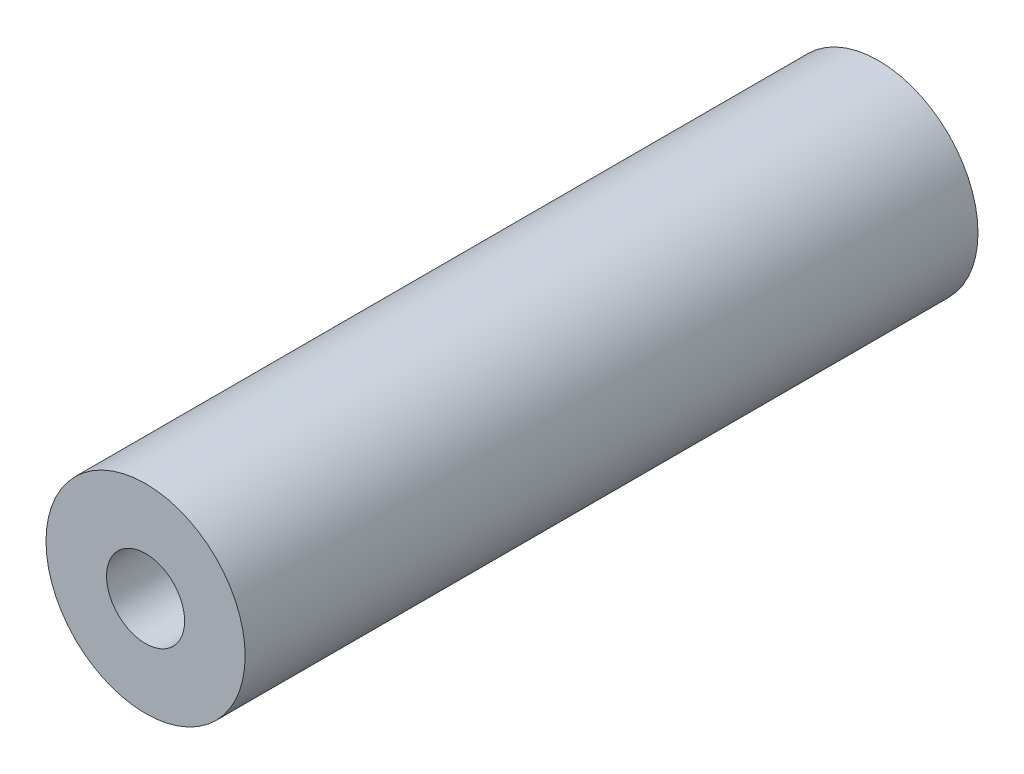
from build123d import *

# Parameters (mm, degrees)
SKETCH1_R           = 6.35
SKETCH1_R_2         = 2.4892
BOSS_EXTRUDE1_DEPTH = 23.368


with BuildPart() as part:
    # Sketch1 → Boss-Extrude1 (new, symmetric)
    with BuildSketch(Plane.XY):
        Circle(SKETCH1_R)
        Circle(SKETCH1_R_2, mode=Mode.SUBTRACT)
    extrude(amount=BOSS_EXTRUDE1_DEPTH, both=True)


solid = part.part
